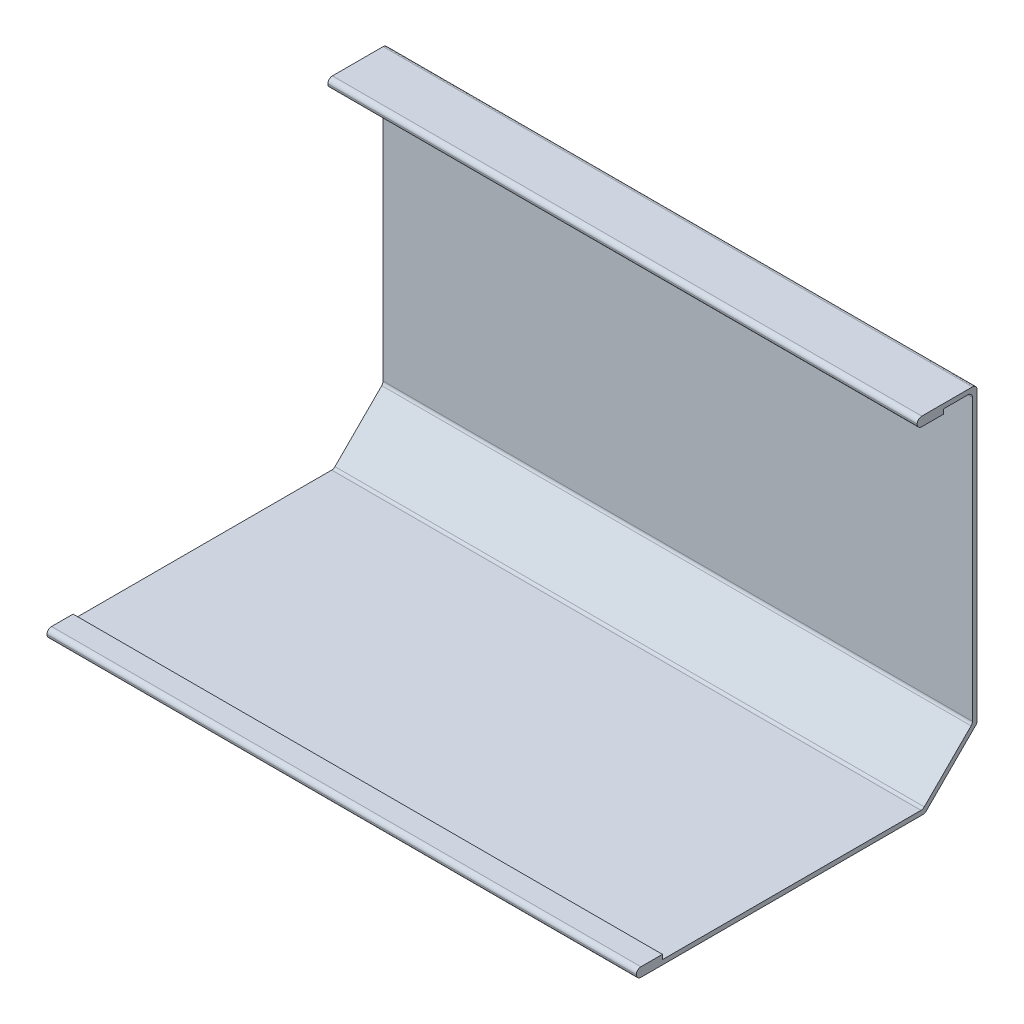
from build123d import *

# Parameters (mm, degrees)
EXTRUDE_1_DEPTH      = 96
EXTRUDE_1_DEPTH_BACK = 96
SKETCH_1_W           = 1.5
SKETCH_1_H           = 8.5
FILLET_1_R           = 1.5


with BuildPart() as part:
    # 草圖1 → 擠出1 (new, two sides: drawn at the far end of the back side and taken through both)
    with BuildSketch(Plane.YZ.offset(-EXTRUDE_1_DEPTH_BACK)):
        Polygon((1.5, 17), (1.5, 17.621320344), (0, 17), align=None)
        Polygon((17.621320344, 1.5), (17, 1.5), (17, 0), align=None)
        with Locations((2.25, 106.75)):
            Rectangle(SKETCH_1_W, SKETCH_1_H)
        with Locations((110.35, 15.25)):
            Rectangle(SKETCH_1_W, SKETCH_1_H)
        Polygon((111.1, 11), (111.1, 1.5), (112.6, 1.5), (112.6, 19.5), (111.1, 19.5), align=None)
        Polygon((17.621320344, 1.5), (17, 1.5), (17, 0), (0, 17), (1.5, 17), (1.5, 17.621320344), align=None)
        Polygon((0, 111), (0, 17), (1.5, 17.621320344), (1.5, 102.5), (1.5, 111), align=None)
        Polygon((17.621320344, 1.5), (17, 0), (112.6, 0), (112.6, 1.5), (111.1, 1.5), align=None)
    extrude(amount=EXTRUDE_1_DEPTH + EXTRUDE_1_DEPTH_BACK)

    # 圓角1
    fillet_1_edges = [part.edges().sort_by_distance(p)[0] for p in [
        (0, 0, 111),
        (0, 3, 111),
        (0, 1.5, 17.621320344),
        (0, 17, 0),
        (0, 0, 17),
        (0, 17.621320344, 1.5),
        (0, 111.1, 1.5),
        (0, 112.6, 0),
        (0, 109.6, 19.5),
        (0, 112.6, 19.5),
    ]]
    fillet(fillet_1_edges, radius=FILLET_1_R - 0.0001)  # a hair under: the kernel refuses the full size


solid = part.part
